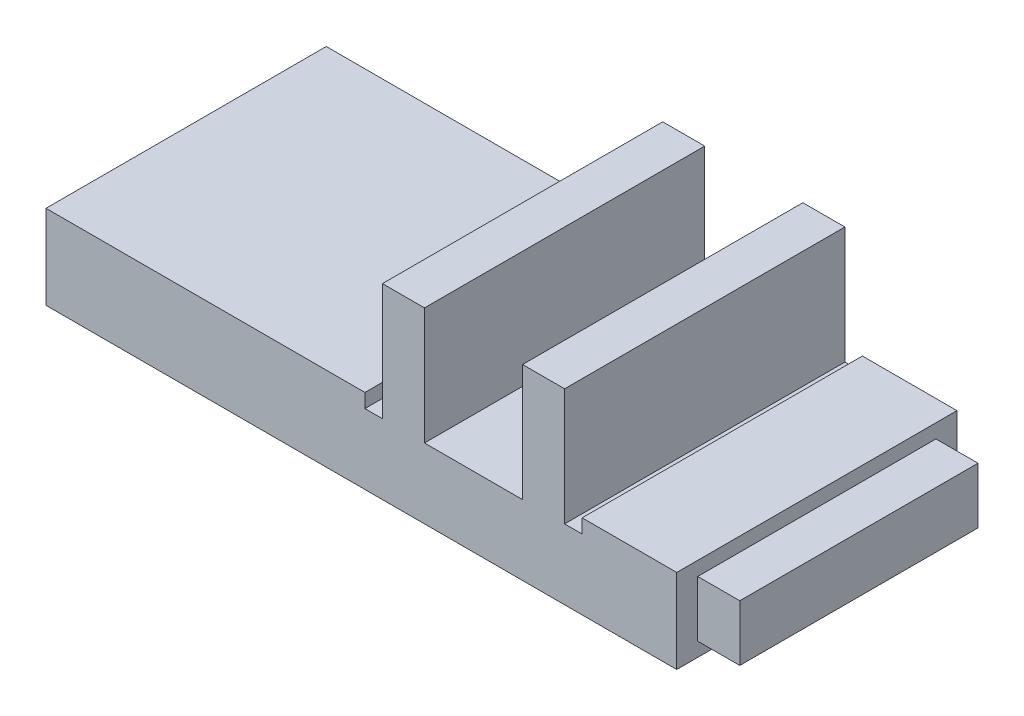
from build123d import *

# Parameters (mm, degrees)
BOSS_EXTRUDE1_DEPTH = 20
SKETCH6_W           = 17
SKETCH6_H           = 4
BOSS_EXTRUDE3_DEPTH = 3
SKETCH7_W           = 3
SKETCH7_H           = 20
BOSS_EXTRUDE4_DEPTH = 8.35


with BuildPart() as part:
    # Sketch2 → Boss-Extrude1 (new body)
    with BuildSketch(Plane.XY):
        Polygon((-7.75, 1), (-30.51, 1), (-30.51, -5), (14.5, -5), (14.5, 1), (7.75, 1), (7.75, 0), (-7.75, 0), align=None)
    extrude(amount=BOSS_EXTRUDE1_DEPTH)

    # Sketch6 → Boss-Extrude3 (add)
    with BuildSketch(Plane(origin=(14.5, 0, 0), x_dir=(0, 0, -1), z_dir=(1, 0, 0))):
        with Locations((-10, -2)):
            Rectangle(SKETCH6_W, SKETCH6_H)
    extrude(amount=BOSS_EXTRUDE3_DEPTH)

    # Sketch7 → Boss-Extrude4 (add)
    with BuildSketch(Plane(origin=(0, 0, 0), x_dir=(1, 0, 0), z_dir=(0, 1, 0))):
        with Locations((-5, -10)):
            Rectangle(SKETCH7_W, SKETCH7_H)
        with Locations((5, -10)):
            Rectangle(SKETCH7_W, SKETCH7_H)
    extrude(amount=BOSS_EXTRUDE4_DEPTH)


solid = part.part
